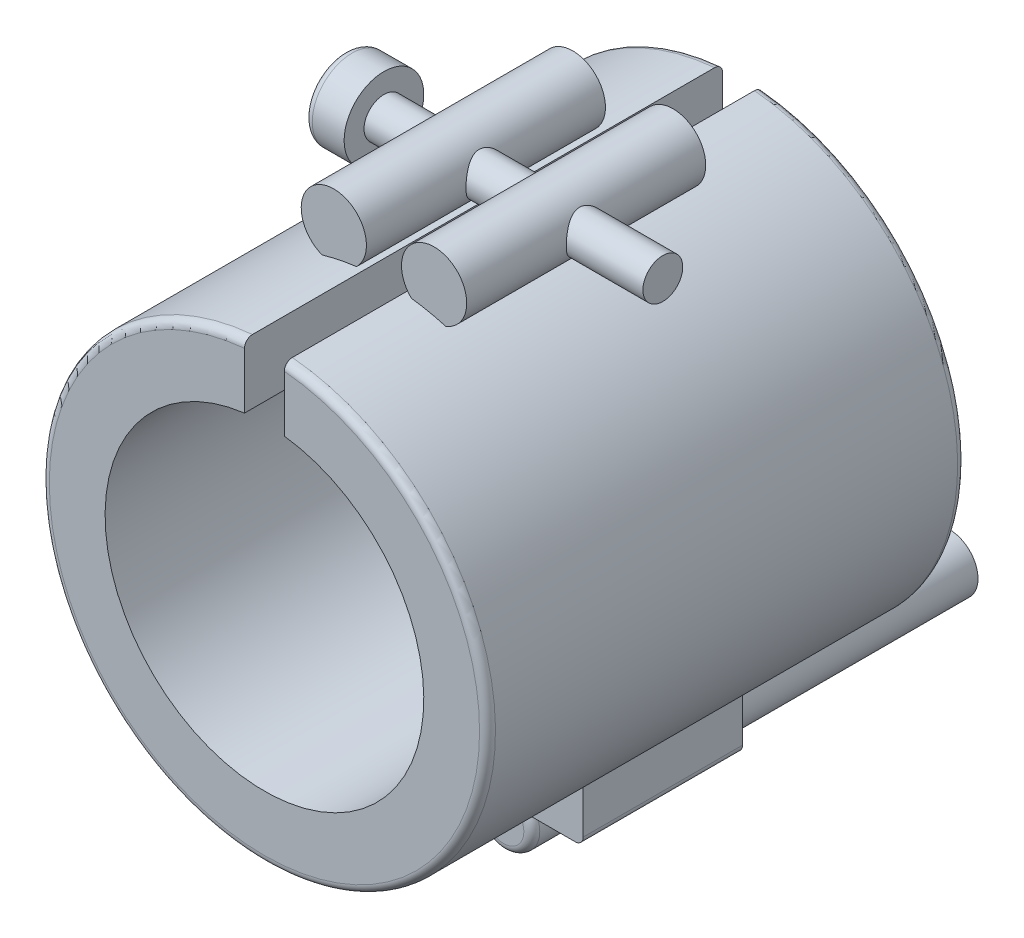
from build123d import *
from build123d.topology import SkipClean

# Parameters (mm, degrees)
BOSS_EXTRUDE1_DEPTH      = 30
SKETCH2_R                = 4.091242679
BOSS_EXTRUDE2_DEPTH      = 15
SKETCH3_W                = 20
SKETCH3_H                = 12.982921918
BOSS_EXTRUDE3_DEPTH      = 20
SKETCH4_R                = 3.5547043
BOSS_EXTRUDE4_DEPTH      = 56
FILLET1_R                = 1
BOSS_EXTRUDE5_DEPTH      = 20
BOSS_EXTRUDE5_DEPTH_BACK = 20
SKETCH5_R                = 2.5
SKETCH6_R                = 5
BOSS_EXTRUDE6_DEPTH      = 5
CUT_EXTRUDE1_DEPTH       = 3
FILLET2_R                = 1


with BuildPart() as part:
    # Sketch1 → Boss-Extrude1 (new, symmetric)
    with BuildSketch(Plane.XY):
        with BuildLine():
            Line((-2.5, 27.888169535), (-2.5, 19.843134833))
            ThreePointArc((-2.5, 19.843134833), (0, -20), (2.5, 19.843134833))
            Line((2.5, 19.843134833), (2.5, 27.888169535))
            ThreePointArc((2.5, 27.888169535), (0, -28), (-2.5, 27.888169535))
        make_face()
    extrude(amount=BOSS_EXTRUDE1_DEPTH, both=True)

    # Sketch2 → Boss-Extrude2 (add, symmetric)
    with BuildSketch(Plane.XY):
        with Locations((6.293533022, 30.722501857)):
            Circle(SKETCH2_R)
        with Locations((-6.293533022, 30.722501857)):
            Circle(SKETCH2_R)
    extrude(amount=BOSS_EXTRUDE2_DEPTH, both=True)

    # Sketch3 → Boss-Extrude3 (add)
    with BuildSketch(Plane.XY):
        with Locations((0, -29.508539041)):
            Rectangle(SKETCH3_W, SKETCH3_H)
    extrude(amount=-BOSS_EXTRUDE3_DEPTH)

    # Sketch4 → Boss-Extrude4 (add)
    with BuildSketch(Plane.XY):
        with Locations((0, -38.127443571)):
            Circle(SKETCH4_R)
    extrude(amount=-BOSS_EXTRUDE4_DEPTH)

    # Fillet1
    # the kernel refuses this fillet: 1 mm, written as the material it adds along each edge
    with BuildSketch(Plane(origin=(10, -26.153393661, -20), x_dir=(0.9297257106590607, 0.3682527704437598, 0), z_dir=(0, 0, 1))) as fillet1_piece_1:
        with BuildLine():
            CenterArc((0.679526652, -0.999928936), FILLET1_R, 90.683068974, 67.709029625)
            Line((-0.250199059, -0.631676166), (0, 0))
            ThreePointArc((0, 0), (0.333802566, -0.001989788), (0.667605131, 0))
        make_face()
    extrude(amount=20)
    with BuildSketch(Plane(origin=(-10, -26.153393661, -20), x_dir=(-0.9297257106590611, 0.36825277044375887, 0), z_dir=(0, 0, 1))) as fillet1_piece_2:
        with BuildLine():
            CenterArc((0.679526652, 0.999928936), FILLET1_R, 201.607901401, 67.709029625)
            Line((-0.250199059, 0.631676166), (0, 0))
            ThreePointArc((0, 0), (0.333802566, 0.001989788), (0.667605131, 0))
        make_face()
    extrude(amount=20)
    # the kernel refuses this fillet: 1 mm, written as the material it takes off along each edge
    with BuildSketch(Plane(origin=(-10, -36, 2.5), x_dir=(1, 0, 0), z_dir=(0, 0, -1)), Plane(origin=(10, -36, 2.5), x_dir=(0, 1, 0), z_dir=(0, 0, -1))) as fillet1_2_piece_1:
        with BuildLine():
            CenterArc((FILLET1_R, -FILLET1_R), FILLET1_R, 90, 90)
            Line((0, -FILLET1_R), (0, 0))
            Line((0, 0), (FILLET1_R, 0))
        make_face()
    extrude(amount=25, mode=Mode.SUBTRACT)
    with BuildSketch(Plane(origin=(0, 0, 30), x_dir=(0.0031415874858796234, 0.9999950652018582, 0), z_dir=(-0.9999950652018582, 0.0031415874858796234, 0))) as fillet1_2_piece_2:
        with BuildLine():
            CenterArc((28 - FILLET1_R, FILLET1_R), FILLET1_R, 270, 90)
            Line((28, FILLET1_R), (28, 0))
            Line((28, 0), (28 - FILLET1_R, 0))
        make_face()
    revolve(axis=Axis((0, 0, 30), (0, 0, -1)), revolution_arc=359.64, mode=Mode.SUBTRACT)
    with BuildSketch(Plane(origin=(0, -38.127443571, 0), x_dir=(-0.2223761713217282, 0.9749609420014165, 0), z_dir=(0.9749609420014165, 0.2223761713217282, 0))) as fillet1_2_piece_3_section:
        with BuildLine():
            CenterArc((3.5547043 - FILLET1_R, -FILLET1_R), FILLET1_R, 0, 90)
            Line((3.5547043, -FILLET1_R), (3.5547043, 0))
            Line((3.5547043, 0), (3.5547043 - FILLET1_R, 0))
        make_face()
    fillet1_2_piece_3 = revolve(axis=Axis((0, -38.127443571, 0), (0, 0, 1)), revolution_arc=257.15136459, mode=Mode.PRIVATE)
    fillet1_2_piece_3 = split(fillet1_2_piece_3, bisect_by=Plane(origin=(-1.545891679, -36, -0.28241258), z_dir=(0, -1, 0)), keep=Keep.TOP, mode=Mode.PRIVATE)
    add(fillet1_2_piece_3, mode=Mode.SUBTRACT)
    with BuildSketch(Plane(origin=(0, 0, -30), x_dir=(0.0031415874858796234, 0.9999950652018582, 0), z_dir=(-0.9999950652018582, 0.0031415874858796234, 0))) as fillet1_2_piece_4:
        with BuildLine():
            CenterArc((28 - FILLET1_R, -FILLET1_R), FILLET1_R, 0, 90)
            Line((28 - FILLET1_R, 0), (28, 0))
            Line((28, 0), (28, -FILLET1_R))
        make_face()
    revolve(axis=Axis((0, 0, -30), (0, 0, -1)), revolution_arc=359.64, mode=Mode.SUBTRACT)
    with BuildSketch(Plane(origin=(0, -38.127443571, 0), x_dir=(1, 0, 0), z_dir=(0, -1, 0))) as fillet1_2_piece_5_section:
        with BuildLine():
            CenterArc((3.5547043 - FILLET1_R, -FILLET1_R), FILLET1_R, 0, 90)
            Line((3.5547043, -FILLET1_R), (3.5547043, 0))
            Line((3.5547043, 0), (3.5547043 - FILLET1_R, 0))
        make_face()
    fillet1_2_piece_5 = revolve(axis=Axis((0, -38.127443571, 0), (0, 0, 1)), revolution_arc=77.060041221, mode=Mode.PRIVATE)
    fillet1_2_piece_5 = split(fillet1_2_piece_5, bisect_by=Plane(origin=(3.06124475, -36, -0.22450263), z_dir=(0, -1, 0)), keep=Keep.TOP, mode=Mode.PRIVATE)
    add(fillet1_2_piece_5, mode=Mode.SUBTRACT)

    # Sketch5 → Boss-Extrude5 (add, two sides: drawn at the far end of the back side and taken through both)
    with SkipClean():  # the faces are left unmerged after this step: merging them gives an invalid solid
        with BuildSketch(Plane(origin=(0, 0, 0), x_dir=(0, 0, -1), z_dir=(1, 0, 0)).offset(-BOSS_EXTRUDE5_DEPTH_BACK)):
            with Locations((0, 30.722501857)):
                Circle(SKETCH5_R)
        extrude(amount=BOSS_EXTRUDE5_DEPTH + BOSS_EXTRUDE5_DEPTH_BACK)

    # Sketch6 → Boss-Extrude6 (add)
    with SkipClean():  # the faces are left unmerged after this step: merging them gives an invalid solid
        with BuildSketch(Plane.ZY.offset(20)):
            with Locations((0, 30.722501857)):
                Circle(SKETCH6_R)
        extrude(amount=-BOSS_EXTRUDE6_DEPTH)

    # Sketch7 → Cut-Extrude1 (cut)
    with SkipClean():  # the faces are left unmerged after this step: merging them gives an invalid solid
        with BuildSketch(Plane.ZY.offset(20)):
            Polygon((1.58771324, 27.972501857), (3.175426481, 30.722501857), (1.58771324, 33.472501857), (-1.58771324, 33.472501857), (-3.175426481, 30.722501857), (-1.58771324, 27.972501857), align=None)
        extrude(amount=-CUT_EXTRUDE1_DEPTH, mode=Mode.SUBTRACT)

    # Fillet2
    fillet2_edges = [part.edges().sort_by_distance(p)[0] for p in [
        (-20, 30.722501857, -5),
    ]]
    fillet(fillet2_edges, radius=FILLET2_R)


solid = part.part
